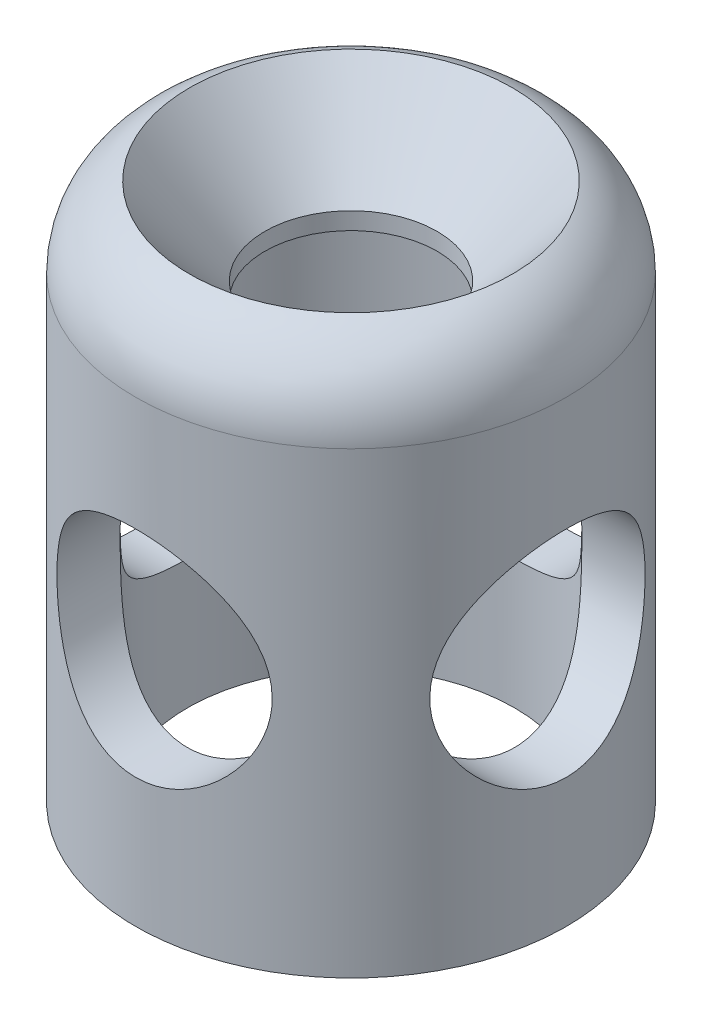
from build123d import *

# Parameters (mm, degrees)
FILLET1_R          = 2.54
SKETCH2_R          = 3.175
CUT_EXTRUDE1_DEPTH = 19.238986472
CIRPATTERN1_COUNT  = 4


with BuildPart() as part:
    # Sketch1 → Revolve1 (revolve)
    with BuildSketch(Plane.XY, mode=Mode.PRIVATE) as revolve1_sk:
        Polygon((6.35, 0), (6.35, 15.875), (4.7625, 15.875), (2.54, 13.318306215), (2.54, 12.810306215), (4.826, 12.810306215), (4.826, 0), align=None)
    revolve(revolve1_sk.sketch.rotate(Axis((0, 0, 0), (0, 1, 0)), 90), axis=Axis((0, 0, 0), (0, 1, 0)))

    # Fillet1
    # the kernel refuses this fillet: 2.54 mm, written as the material it takes off along each edge
    with BuildSketch(Plane(origin=(0, 15.875, 0), x_dir=(0, 0, -1), z_dir=(1, 0, 0))) as fillet1_piece_1:
        with BuildLine():
            CenterArc((3.81, -2.35464302), FILLET1_R, 0, 67.975687163)
            Line((4.7625, 0), (4.78155, 0.04709286))
            ThreePointArc((4.78155, 0.04709286), (5.55625, 0.0508), (6.35, 0.0508))
            Line((6.35, 0.0508), (6.4008, 0))
            Line((6.4008, 0), (6.4008, -2.35464302))
            Line((6.4008, -2.35464302), (6.35, -2.35464302))
        make_face()
    revolve(axis=Axis((0, 15.875, 0), (0, 1, 0)), mode=Mode.SUBTRACT)

    # Sketch2 → Cut-Extrude1 (cut, symmetric)
    with BuildSketch(Plane(origin=(0, 0, 0), x_dir=(0, 0, -1), z_dir=(1, 0, 0))):
        with Locations((0, 6.985)):
            Circle(SKETCH2_R)
    cut_extrude1 = extrude(amount=CUT_EXTRUDE1_DEPTH, both=True, mode=Mode.SUBTRACT)

    # CirPattern1: Cut-Extrude1 ×4 about axis
    cirpattern1_axis = Axis((0, 12.810306215, 0), (0, -1, 0))
    for i in range(1, CIRPATTERN1_COUNT):
        add(cut_extrude1.rotate(cirpattern1_axis, i * 360 / CIRPATTERN1_COUNT), mode=Mode.SUBTRACT)


solid = part.part
